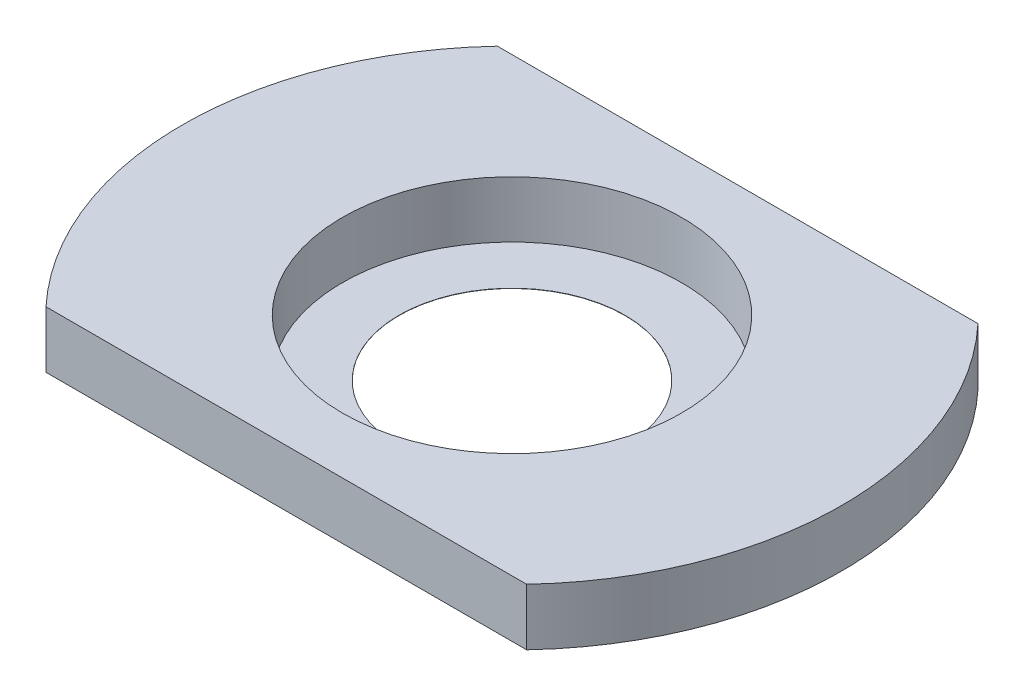
from build123d import *

# Parameters (mm, degrees)
SKETCH1_R                = 1750
BOSS_EXTRUDE1_DEPTH      = 500
SKETCH2_R                = 900
CUT_EXTRUDE2_DEPTH       = 300
CUT_EXTRUDE10_DEPTH      = 2525.876234591
CUT_EXTRUDE10_DEPTH_BACK = 2525.876234591
SKETCH9_W                = 5273.235769222
SKETCH9_H                = 4165.824449254
SKETCH9_W_2              = 4212.623718326
SKETCH9_H_2              = 2396.11984
SKETCH3_R                = 600
CUT_EXTRUDE3_DEPTH       = 300
SHELL1_T                 = -1.5
SKETCH10_W               = 4453.085199548
SKETCH10_H               = 3102.078328882
CUT_EXTRUDE11_DEPTH      = 2143.136742113


with BuildPart() as part:
    # Sketch1 → Boss-Extrude1 (new body)
    with BuildSketch(Plane(origin=(0, 0, 0), x_dir=(1, 0, 0), z_dir=(0, 1, 0))):
        Circle(SKETCH1_R)
    extrude(amount=BOSS_EXTRUDE1_DEPTH)

    # Sketch2 → Cut-Extrude2 (cut)
    with BuildSketch(Plane(origin=(0, 500, 0), x_dir=(1, 0, 0), z_dir=(0, 1, 0))):
        Circle(SKETCH2_R)
    extrude(amount=-CUT_EXTRUDE2_DEPTH, mode=Mode.SUBTRACT)

    # Sketch9 → Cut-Extrude10 (cut, two sides: drawn at the far end of the back side and taken through both)
    with BuildSketch(Plane.XZ.offset(-CUT_EXTRUDE10_DEPTH_BACK)):
        Rectangle(SKETCH9_W, SKETCH9_H)
        Rectangle(SKETCH9_W_2, SKETCH9_H_2, mode=Mode.SUBTRACT)
    extrude(amount=CUT_EXTRUDE10_DEPTH + CUT_EXTRUDE10_DEPTH_BACK, mode=Mode.SUBTRACT)

    # Sketch3 → Cut-Extrude3 (cut)
    with BuildSketch(Plane.XZ):
        Circle(SKETCH3_R)
    extrude(amount=-CUT_EXTRUDE3_DEPTH, mode=Mode.SUBTRACT)

    # Shell1
    shell1_openings = [part.faces().sort_by_distance(p)[0] for p in [
        (1707.583740986, 0, 0),
    ]]
    offset(amount=SHELL1_T, openings=shell1_openings, kind=Kind.INTERSECTION)

    # Sketch10 → Cut-Extrude11 (cut, through all)
    with BuildSketch(Plane.XZ.offset(-198.5)):
        Rectangle(SKETCH10_W, SKETCH10_H)
    extrude(amount=CUT_EXTRUDE11_DEPTH, mode=Mode.SUBTRACT)


solid = part.part
